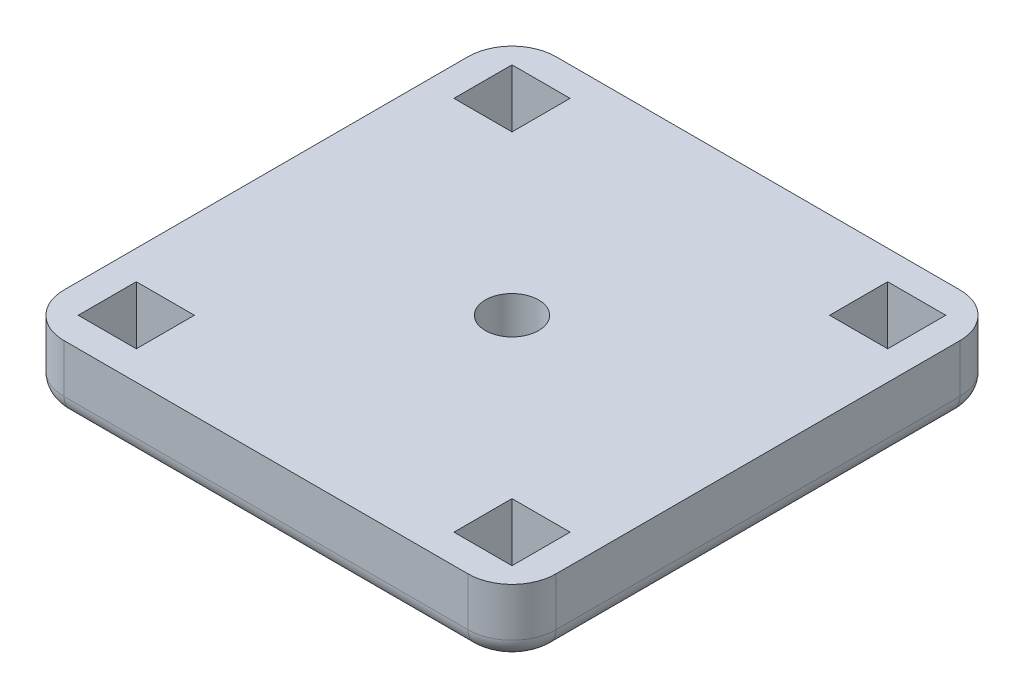
from build123d import *

# Parameters (mm, degrees)
SKETCH1_W           = 50.8
SKETCH1_H           = 50.8
SKETCH1_R           = 2.75
SKETCH1_W_2         = 6
SKETCH1_H_2         = 6
BOSS_EXTRUDE1_DEPTH = 7
FILLET1_R           = 2
FILLET2_R           = 4.54


with BuildPart() as part:
    # Sketch1 → Boss-Extrude1 (new body)
    with BuildSketch(Plane(origin=(0, 0, 0), x_dir=(1, 0, 0), z_dir=(0, 1, 0))):
        Rectangle(SKETCH1_W, SKETCH1_H)
        with Locations(Location((0, 0, 0), (0, 0, 270))):
            Circle(SKETCH1_R, mode=Mode.SUBTRACT)
        with Locations((-19.4, 19.4)):
            Rectangle(SKETCH1_W_2, SKETCH1_H_2, mode=Mode.SUBTRACT)
        with Locations((19.4, 19.4)):
            Rectangle(SKETCH1_W_2, SKETCH1_H_2, mode=Mode.SUBTRACT)
        with Locations((-19.4, -19.4)):
            Rectangle(SKETCH1_W_2, SKETCH1_H_2, mode=Mode.SUBTRACT)
        with Locations((19.4, -19.4)):
            Rectangle(SKETCH1_W_2, SKETCH1_H_2, mode=Mode.SUBTRACT)
    extrude(amount=BOSS_EXTRUDE1_DEPTH)

    # Fillet1
    fillet1_edges = [part.edges().sort_by_distance(p)[0] for p in [
        (0, 0, 25.4),
        (-25.4, 0, 0),
        (0, 0, -25.4),
        (25.4, 0, 0),
    ]]
    fillet(fillet1_edges, radius=FILLET1_R)

    # Fillet2
    # the kernel refuses this fillet: 4.54 mm, written as the material it takes off along each edge
    with BuildSketch(Plane(origin=(20.86, 0, -20.86), x_dir=(0, 0, -1), z_dir=(-1, 0, 0))) as fillet2_piece_1:
        with BuildLine():
            CenterArc((2.54, -2), 2, 0, 90)
            Line((4.54, -2), (4.54, 0))
            Line((4.54, 0), (2.54, 0))
        make_face()
    revolve(axis=Axis((20.86, 0, -20.86), (0, -1, 0)), revolution_arc=90, mode=Mode.SUBTRACT)
    with BuildSketch(Plane(origin=(20.86, 0, 20.86), x_dir=(1, 0, 0), z_dir=(0, 0, -1))) as fillet2_piece_2:
        with BuildLine():
            CenterArc((2.54, -2), 2, 0, 90)
            Line((4.54, -2), (4.54, 0))
            Line((4.54, 0), (2.54, 0))
        make_face()
    revolve(axis=Axis((20.86, 0, 20.86), (0, -1, 0)), revolution_arc=90, mode=Mode.SUBTRACT)
    with BuildSketch(Plane(origin=(-20.86, 0, -20.86), x_dir=(-1, 0, 0), z_dir=(0, 0, 1))) as fillet2_piece_3:
        with BuildLine():
            CenterArc((2.54, -2), 2, 0, 90)
            Line((4.54, -2), (4.54, 0))
            Line((4.54, 0), (2.54, 0))
        make_face()
    revolve(axis=Axis((-20.86, 0, -20.86), (0, -1, 0)), revolution_arc=90, mode=Mode.SUBTRACT)
    with BuildSketch(Plane(origin=(-20.86, 0, 20.86), x_dir=(0, 0, 1), z_dir=(1, 0, 0))) as fillet2_piece_4:
        with BuildLine():
            CenterArc((2.54, -2), 2, 0, 90)
            Line((4.54, -2), (4.54, 0))
            Line((4.54, 0), (2.54, 0))
        make_face()
    revolve(axis=Axis((-20.86, 0, 20.86), (0, -1, 0)), revolution_arc=90, mode=Mode.SUBTRACT)
    with BuildSketch(Plane(origin=(25.4, 0, 25.4), x_dir=(0, 0, -1), z_dir=(0, 1, 0)), Plane(origin=(25.4, 0, -25.4), x_dir=(-1, 0, 0), z_dir=(0, 1, 0))) as fillet2_piece_5:
        with BuildLine():
            CenterArc((FILLET2_R, FILLET2_R), FILLET2_R, 180, 90)
            Line((0, FILLET2_R), (0, 0))
            Line((0, 0), (FILLET2_R, 0))
        make_face()
    extrude(amount=18.35, mode=Mode.SUBTRACT)
    with BuildSketch(Plane(origin=(-25.4, 0, 25.4), x_dir=(0, 0, -1), z_dir=(0, 1, 0)), Plane(origin=(-25.4, 0, -25.4), x_dir=(1, 0, 0), z_dir=(0, 1, 0))) as fillet2_piece_6:
        with BuildLine():
            CenterArc((FILLET2_R, -FILLET2_R), FILLET2_R, 90, 90)
            Line((0, -FILLET2_R), (0, 0))
            Line((0, 0), (FILLET2_R, 0))
        make_face()
    extrude(amount=18.35, mode=Mode.SUBTRACT)


solid = part.part
